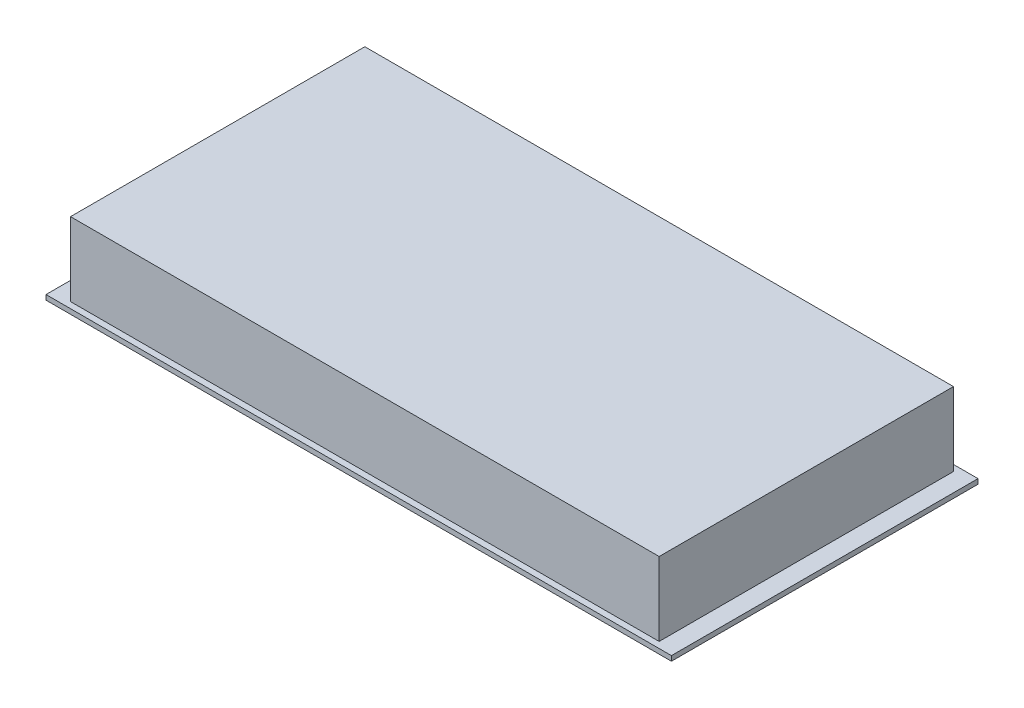
from build123d import *

# Parameters (mm, degrees)
SKETCH1_W           = 304.8
SKETCH1_H           = 152.4
BOSS_EXTRUDE1_DEPTH = 38.1
SKETCH2_W           = 323.85
SKETCH2_H           = 158.75
BOSS_EXTRUDE2_DEPTH = 2.54


with BuildPart() as part:
    # Sketch1 → Boss-Extrude1 (new body)
    with BuildSketch(Plane(origin=(0, 0, 0), x_dir=(1, 0, 0), z_dir=(0, 1, 0))):
        Rectangle(SKETCH1_W, SKETCH1_H)
    extrude(amount=BOSS_EXTRUDE1_DEPTH)

    # Sketch2 → Boss-Extrude2 (add)
    with BuildSketch(Plane.XZ):
        Rectangle(SKETCH2_W, SKETCH2_H)
    extrude(amount=BOSS_EXTRUDE2_DEPTH)


solid = part.part
